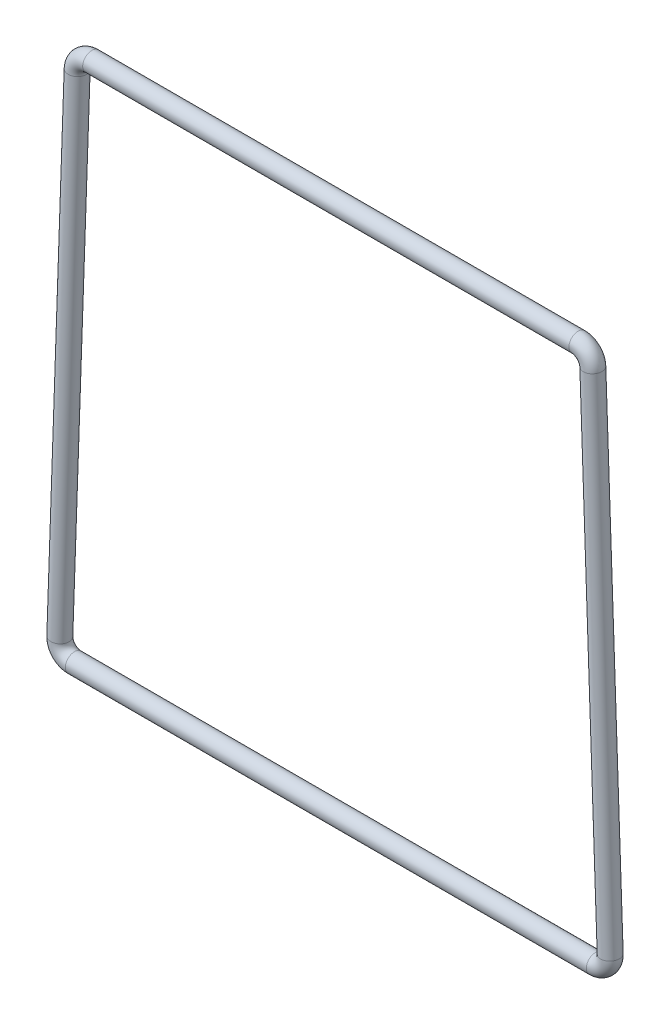
from build123d import *

# Parameters (mm, degrees)
CROQUIS2_R = 1.25


with BuildPart() as part:
    # Barrer1: sweep along a path in Croquis1
    with BuildLine(Plane.XY) as barrer1_path:
        Line((0, 0), (35.429350286, 0))
        ThreePointArc((35.429350286, 0), (36.867892124, 0.610540616), (37.428145742, 2.06940262))
        Line((37.428145742, 2.06940262), (35.067034631, 70.06940262))
        ThreePointArc((35.067034631, 70.06940262), (34.457698559, 71.438541838), (33.068239175, 72))
        Line((33.068239175, 72), (0, 72))
    # Croquis2 → Barrer1 (sweep)
    with BuildSketch(Plane(origin=(0, 0, 0), x_dir=(0, 0, -1), z_dir=(1, 0, 0))):
        with Locations((0, 72)):
            Circle(CROQUIS2_R)
    barrer1 = sweep(path=barrer1_path.line)

    # Simetría1: Barrer1 across plane
    add(barrer1.mirror(Plane(origin=(0, 72, 0), x_dir=(0, 0, 1), z_dir=(1, 0, 0))))


solid = part.part
